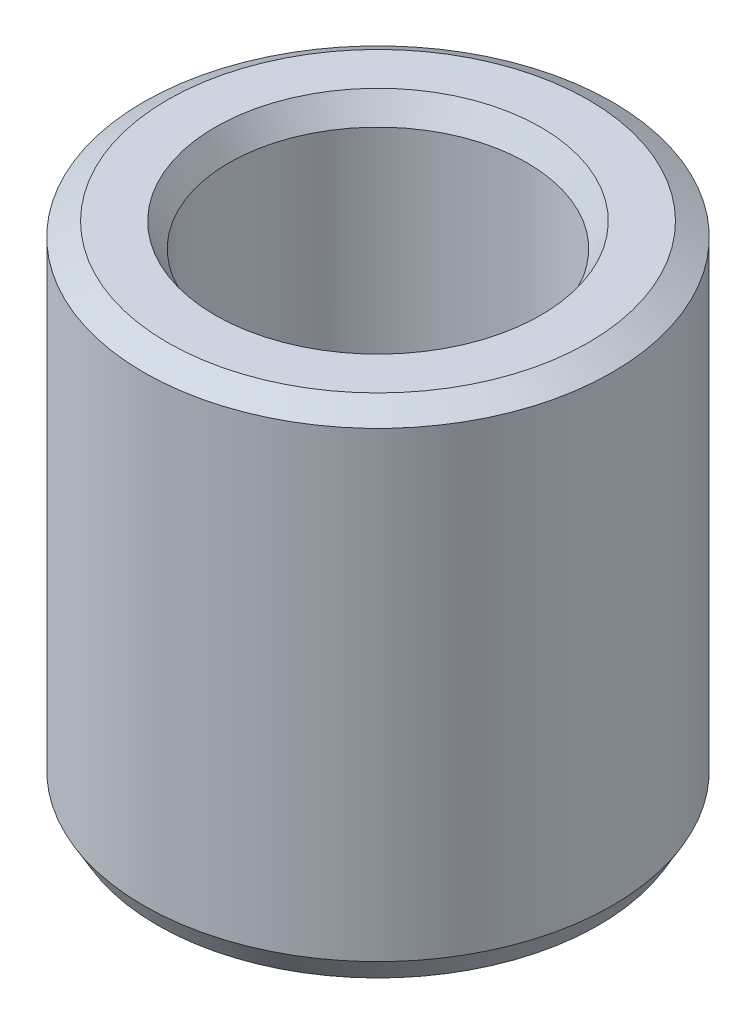
from build123d import *
from OCP.BRepFilletAPI import BRepFilletAPI_MakeChamfer

# Parameters (mm, degrees)
SKETCH1_R           = 45
BOSS_EXTRUDE1_DEPTH = 95.952636169
SKETCH2_R           = 28.629563882
CUT_EXTRUDE1_DEPTH  = 116.138648541
CHAMFER1_SIZE       = 2.652062635
CHAMFER1_SIZE2      = 4.593507228


with BuildPart() as part:
    # Sketch1 → Boss-Extrude1 (new body)
    with BuildSketch(Plane(origin=(0, 0, 0), x_dir=(1, 0, 0), z_dir=(0, 1, 0))):
        Circle(SKETCH1_R)
    extrude(amount=BOSS_EXTRUDE1_DEPTH)

    # Sketch2 → Cut-Extrude1 (cut, through all)
    with BuildSketch(Plane(origin=(0, 0, 0), x_dir=(1, 0, 0), z_dir=(0, 1, 0))):
        Circle(SKETCH2_R)
    extrude(amount=CUT_EXTRUDE1_DEPTH, mode=Mode.SUBTRACT)

    # Chamfer1: one chamfer whose edges measure the first distance from different faces: ONE call of the kernel's chamfer builder (chamfer() names one face for all edges)
    chamfer1_edges_1 = [part.edges().sort_by_distance(p)[0] for p in [
        (-28.629563882, 95.952636169, 0),
    ]]
    chamfer1_side_1 = [part.faces().sort_by_distance(p)[0] for p in [
        (-43.727207794, 95.952636169, 0),
    ]]
    chamfer1_edges_2 = [part.edges().sort_by_distance(p)[0] for p in [
        (-28.629563882, 0, 0),
    ]]
    chamfer1_side_2 = [part.faces().sort_by_distance(p)[0] for p in [
        (-28.629563882, 47.976318084, 0),
    ]]
    chamfer1_edges_3 = [part.edges().sort_by_distance(p)[0] for p in [
        (-45, 0, 0),
    ]]
    chamfer1_side_3 = [part.faces().sort_by_distance(p)[0] for p in [
        (-43.727207794, 0, 0),
    ]]
    chamfer1_edges_4 = [part.edges().sort_by_distance(p)[0] for p in [
        (-45, 95.952636169, 0),
    ]]
    chamfer1_side_4 = [part.faces().sort_by_distance(p)[0] for p in [
        (-45, 47.976318084, 0),
    ]]
    chamfer1 = BRepFilletAPI_MakeChamfer(part.part.solid().wrapped)
    for e in chamfer1_edges_1:
        chamfer1.Add(CHAMFER1_SIZE, CHAMFER1_SIZE2, e.wrapped, chamfer1_side_1[0].wrapped)  # the first distance lies on this face
    for e in chamfer1_edges_2:
        chamfer1.Add(CHAMFER1_SIZE, CHAMFER1_SIZE2, e.wrapped, chamfer1_side_2[0].wrapped)  # the first distance lies on this face
    for e in chamfer1_edges_3:
        chamfer1.Add(CHAMFER1_SIZE, CHAMFER1_SIZE2, e.wrapped, chamfer1_side_3[0].wrapped)  # the first distance lies on this face
    for e in chamfer1_edges_4:
        chamfer1.Add(CHAMFER1_SIZE, CHAMFER1_SIZE2, e.wrapped, chamfer1_side_4[0].wrapped)  # the first distance lies on this face
    add(Compound.cast(chamfer1.Shape()), mode=Mode.REPLACE)


solid = part.part
